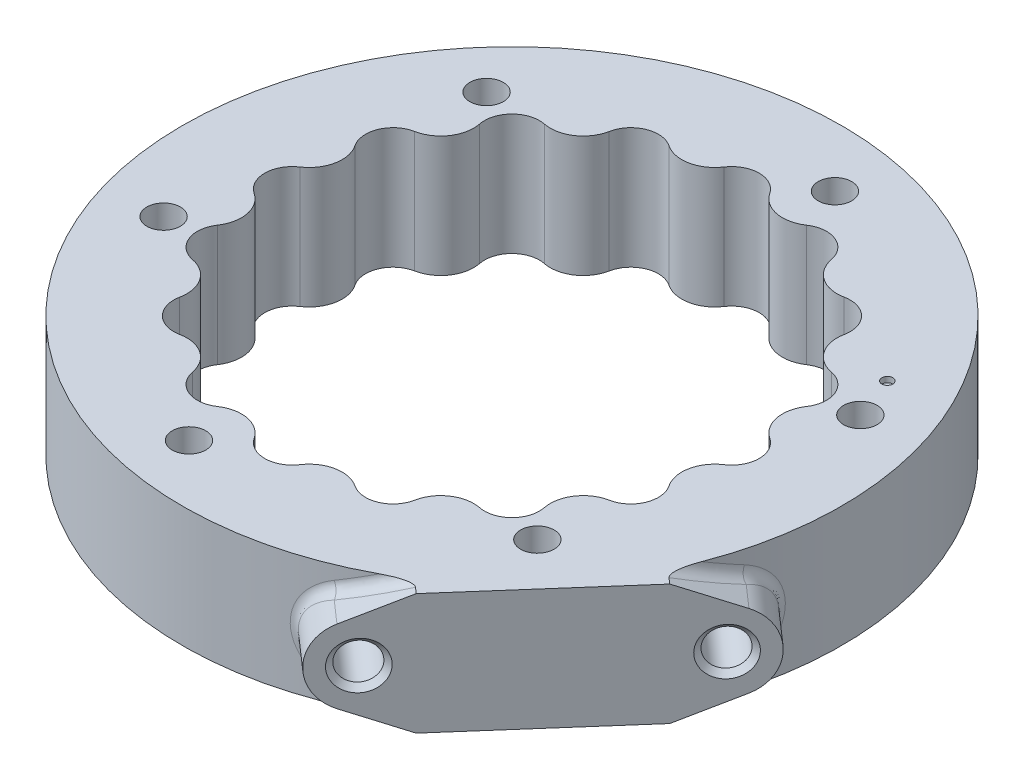
from build123d import *

# Parameters (mm, degrees)
SKETCH1_R                = 60
BOSS_EXTRUDE1_DEPTH      = 22
FILLET1_R                = 5
FILLET2_R                = 6
SKETCH3_R                = 3.05
CUT_EXTRUDE1_DEPTH       = 88.658428165
BOSS_EXTRUDE3_REACH      = 149.334
BOSS_EXTRUDE3_END_RADIUS = 60
SKETCH7_R                = 3.3
CUT_EXTRUDE3_DEPTH       = 10.5
CHAMFER2_SIZE            = 1
FILLET3_R                = 2
SKETCH8_W                = 32.70355213
SKETCH8_H                = 5.5
CUT_EXTRUDE4_DEPTH       = 149.347998989
SKETCH10_R               = 1
CUT_EXTRUDE6_DEPTH       = 1


with BuildPart() as part:
    # Sketch1 → Boss-Extrude1 (new body)
    with BuildSketch(Plane(origin=(0, 0, 0), x_dir=(1, 0, 0), z_dir=(0, 1, 0))):
        with Locations(Location((0, 0, 0), (0, 0, 270))):
            Circle(SKETCH1_R)
        with BuildLine():
            ThreePointArc((-31.591922188, 24.534678569), (-33.258784492, 22.222809321), (-34.756792584, 19.798115295))
            ThreePointArc((-34.756792584, 19.798115295), (-41.574578963, 17.220754456), (-38.576145309, 10.577382149))
            ThreePointArc((-38.576145309, 10.577382149), (-39.231411216, 7.803612881), (-39.6875, 4.99022482))
            ThreePointArc((-39.6875, 4.99022482), (-45, 0), (-39.6875, -4.99022482))
            ThreePointArc((-39.6875, -4.99022482), (-39.231411216, -7.803612881), (-38.576145309, -10.577382149))
            ThreePointArc((-38.576145309, -10.577382149), (-41.574578963, -17.220754456), (-34.756792584, -19.798115295))
            ThreePointArc((-34.756792584, -19.798115295), (-33.258784492, -22.222809321), (-31.591922188, -24.534678569))
            ThreePointArc((-31.591922188, -24.534678569), (-31.819805153, -31.819805153), (-24.534678569, -31.591922188))
            ThreePointArc((-24.534678569, -31.591922188), (-22.222809321, -33.258784492), (-19.798115295, -34.756792584))
            ThreePointArc((-19.798115295, -34.756792584), (-17.220754456, -41.574578963), (-10.577382149, -38.576145309))
            ThreePointArc((-10.577382149, -38.576145309), (-7.803612881, -39.231411216), (-4.99022482, -39.6875))
            ThreePointArc((-4.99022482, -39.6875), (0, -45), (4.99022482, -39.6875))
            ThreePointArc((4.99022482, -39.6875), (7.803612881, -39.231411216), (10.577382149, -38.576145309))
            ThreePointArc((10.577382149, -38.576145309), (17.220754456, -41.574578963), (19.798115295, -34.756792584))
            ThreePointArc((19.798115295, -34.756792584), (22.222809321, -33.258784492), (24.534678569, -31.591922188))
            ThreePointArc((24.534678569, -31.591922188), (31.819805153, -31.819805153), (31.591922188, -24.534678569))
            ThreePointArc((31.591922188, -24.534678569), (33.258784492, -22.222809321), (34.756792584, -19.798115295))
            ThreePointArc((34.756792584, -19.798115295), (41.574578963, -17.220754456), (38.576145309, -10.577382149))
            ThreePointArc((38.576145309, -10.577382149), (39.231411216, -7.803612881), (39.6875, -4.99022482))
            ThreePointArc((39.6875, -4.99022482), (45, 0), (39.6875, 4.99022482))
            ThreePointArc((39.6875, 4.99022482), (39.231411216, 7.803612881), (38.576145309, 10.577382149))
            ThreePointArc((38.576145309, 10.577382149), (41.574578963, 17.220754456), (34.756792584, 19.798115295))
            ThreePointArc((34.756792584, 19.798115295), (33.258784492, 22.222809321), (31.591922188, 24.534678569))
            ThreePointArc((31.591922188, 24.534678569), (31.819805153, 31.819805153), (24.534678569, 31.591922188))
            ThreePointArc((24.534678569, 31.591922188), (22.222809321, 33.258784492), (19.798115295, 34.756792584))
            ThreePointArc((19.798115295, 34.756792584), (17.220754456, 41.574578963), (10.577382149, 38.576145309))
            ThreePointArc((10.577382149, 38.576145309), (7.803612881, 39.231411216), (4.99022482, 39.6875))
            ThreePointArc((4.99022482, 39.6875), (0, 45), (-4.99022482, 39.6875))
            ThreePointArc((-4.99022482, 39.6875), (-7.803612881, 39.231411216), (-10.577382149, 38.576145309))
            ThreePointArc((-10.577382149, 38.576145309), (-17.220754456, 41.574578963), (-19.798115295, 34.756792584))
            ThreePointArc((-19.798115295, 34.756792584), (-22.222809321, 33.258784492), (-24.534678569, 31.591922188))
            ThreePointArc((-24.534678569, 31.591922188), (-31.819805153, 31.819805153), (-31.591922188, 24.534678569))
        make_face(mode=Mode.SUBTRACT)
    extrude(amount=BOSS_EXTRUDE1_DEPTH)

    # Fillet1
    # the kernel refuses this fillet: 5 mm, written as the material it takes off along each edge
    with BuildSketch(Plane(origin=(-31.591922188, -7.937782114, -24.534678569), x_dir=(-0.5708127348451637, 0, -0.8210802772802334), z_dir=(0, 1, 0))) as fillet1_piece_1:
        with BuildLine():
            CenterArc((3.572001951, 4.856162203), FILLET1_R, 201.908932705, 54.314665287)
            ThreePointArc((-1.066888508, 2.990500041), (-0.503760138, 1.505840103), (0, 0))
            ThreePointArc((0, 0), (1.190667317, 0.143837797), (2.381334634, 0))
        make_face()
    extrude(amount=37.875564228, mode=Mode.SUBTRACT)
    with BuildSketch(Plane(origin=(-34.756792584, -7.937782114, -19.798115295), x_dir=(-0.977019839336146, 0, -0.21314838386338178), z_dir=(0, 1, 0)), Plane(origin=(10.577382149, -7.937782114, 38.576145309), x_dir=(0.5401386861196337, 0, 0.8415760213771278), z_dir=(0, 1, 0)), Plane(origin=(-4.99022482, -7.937782114, 39.6875), x_dir=(0.176965876366712, 0, 0.984216987560041), z_dir=(0, 1, 0)), Plane(origin=(-19.798115295, -7.937782114, 34.756792584), x_dir=(-0.21314838386337953, 0, 0.9770198393361466), z_dir=(0, 1, 0)), Plane(origin=(-31.591922188, -7.937782114, 24.534678569), x_dir=(-0.5708127348451787, 0, 0.8210802772802229), z_dir=(0, 1, 0)), Plane(origin=(-38.576145309, -7.937782114, 10.577382149), x_dir=(-0.84157602137713, 0, 0.5401386861196305), z_dir=(0, 1, 0)), Plane(origin=(-39.6875, -7.937782114, -4.99022482), x_dir=(-0.9842169875600411, 0, 0.17696587636671054), z_dir=(0, 1, 0)), Plane(origin=(24.534678569, -7.937782114, 31.591922188), x_dir=(0.8210802772802258, 0, 0.5708127348451744), z_dir=(0, 1, 0)), Plane(origin=(34.756792584, -7.937782114, 19.798115295), x_dir=(0.9770198393361469, 0, 0.2131483838633775), z_dir=(0, 1, 0)), Plane(origin=(39.6875, -7.937782114, 4.99022482), x_dir=(0.9842169875600401, 0, -0.1769658763667165), z_dir=(0, 1, 0)), Plane(origin=(38.576145309, -7.937782114, -10.577382149), x_dir=(0.8415760213771245, 0, -0.5401386861196388), z_dir=(0, 1, 0)), Plane(origin=(31.591922188, -7.937782114, -24.534678569), x_dir=(0.5708127348451758, 0, -0.8210802772802248), z_dir=(0, 1, 0)), Plane(origin=(19.798115295, -7.937782114, -34.756792584), x_dir=(0.21314838386337198, 0, -0.9770198393361482), z_dir=(0, 1, 0)), Plane(origin=(4.99022482, -7.937782114, -39.6875), x_dir=(-0.17696587636672031, 0, -0.9842169875600394), z_dir=(0, 1, 0)), Plane(origin=(-10.577382149, -7.937782114, -38.576145309), x_dir=(-0.5401386861196261, 0, -0.8415760213771326), z_dir=(0, 1, 0)), Plane(origin=(-24.534678569, -7.937782114, -31.591922188), x_dir=(-0.82108027728022, 0, -0.5708127348451829), z_dir=(0, 1, 0))) as fillet1_piece_2:
        with BuildLine():
            CenterArc((3.572001951, -4.856162203), FILLET1_R, 103.776402008, 54.314665287)
            ThreePointArc((-1.066888508, -2.990500041), (-0.503760138, -1.505840103), (0, 0))
            ThreePointArc((0, 0), (1.190667317, -0.143837797), (2.381334634, 0))
        make_face()
    extrude(amount=37.875564228, mode=Mode.SUBTRACT)
    with BuildSketch(Plane(origin=(4.99022482, -7.937782114, 39.6875), x_dir=(0.9864543257067245, 0, -0.1640361645933343), z_dir=(0, 1, 0)), Plane(origin=(-10.577382149, -7.937782114, 38.576145309), x_dir=(0.9741388837762464, 0, 0.22595007217340898), z_dir=(0, 1, 0)), Plane(origin=(-24.534678569, -7.937782114, 31.591922188), x_dir=(0.8135196273818055, 0, 0.5815374586942516), z_dir=(0, 1, 0)), Plane(origin=(-34.756792584, -7.937782114, 19.798115295), x_dir=(0.5290493822922732, 0, 0.8485910387790836), z_dir=(0, 1, 0)), Plane(origin=(-39.6875, -7.937782114, 4.99022482), x_dir=(0.1640361645933272, 0, 0.9864543257067256), z_dir=(0, 1, 0)), Plane(origin=(-38.576145309, -7.937782114, -10.577382149), x_dir=(-0.22595007217340937, 0, 0.9741388837762464), z_dir=(0, 1, 0)), Plane(origin=(19.798115295, -7.937782114, 34.756792584), x_dir=(0.8485910387790846, 0, -0.5290493822922715), z_dir=(0, 1, 0)), Plane(origin=(31.591922188, -7.937782114, 24.534678569), x_dir=(0.5815374586942491, 0, -0.8135196273818073), z_dir=(0, 1, 0)), Plane(origin=(38.576145309, -7.937782114, 10.577382149), x_dir=(0.22595007217340277, 0, -0.9741388837762479), z_dir=(0, 1, 0)), Plane(origin=(39.6875, -7.937782114, -4.99022482), x_dir=(-0.16403616459333684, 0, -0.9864543257067241), z_dir=(0, 1, 0)), Plane(origin=(34.756792584, -7.937782114, -19.798115295), x_dir=(-0.5290493822922758, 0, -0.8485910387790819), z_dir=(0, 1, 0)), Plane(origin=(24.534678569, -7.937782114, -31.591922188), x_dir=(-0.8135196273818096, 0, -0.5815374586942458), z_dir=(0, 1, 0)), Plane(origin=(10.577382149, -7.937782114, -38.576145309), x_dir=(-0.9741388837762485, 0, -0.22595007217340046), z_dir=(0, 1, 0)), Plane(origin=(-4.99022482, -7.937782114, -39.6875), x_dir=(-0.9864543257067236, 0, 0.16403616459333964), z_dir=(0, 1, 0)), Plane(origin=(-19.798115295, -7.937782114, -34.756792584), x_dir=(-0.8485910387790874, 0, 0.5290493822922673), z_dir=(0, 1, 0))) as fillet1_piece_3:
        with BuildLine():
            CenterArc((3.373557398, -4.996060424), FILLET1_R, 92.274604499, 54.314665287)
            ThreePointArc((-0.800166381, -2.24287503), (-0.264608655, -1.169769307), (0, 0))
            ThreePointArc((0, 0), (1.587556423, -0.031516609), (3.175112846, 0))
        make_face()
    extrude(amount=37.875564228, mode=Mode.SUBTRACT)

    # Fillet2
    fillet2_edges = [part.edges().sort_by_distance(p)[0] for p in [
        (-7.805937782, 11, 39.243099283),
        (7.805937782, 11, 39.243099283),
        (22.229430079, 11, 33.268693157),
        (33.268693157, 11, 22.229430079),
        (-22.229430079, 11, 33.268693157),
        (-33.268693157, 11, 22.229430079),
        (-39.243099283, 11, 7.805937782),
        (-39.243099283, 11, -7.805937782),
        (39.243099283, 11, 7.805937782),
        (39.243099283, 11, -7.805937782),
        (33.268693157, 11, -22.229430079),
        (22.229430079, 11, -33.268693157),
        (7.805937782, 11, -39.243099283),
        (-7.805937782, 11, -39.243099283),
        (-22.229430079, 11, -33.268693157),
        (-33.268693157, 11, -22.229430079),
    ]]
    fillet(fillet2_edges, radius=FILLET2_R)

    # Sketch3 → Cut-Extrude1 (cut, through all)
    with BuildSketch(Plane(origin=(0, 22, 0), x_dir=(1, 0, 0), z_dir=(0, 1, 0))):
        with Locations(Location((9.754516101, 49.03926402, 0), (0, 0, 270))):
            Circle(SKETCH3_R)
        with Locations(Location((47.346506475, 16.071973265, 0), (0, 0, 270))):
            Circle(SKETCH3_R)
        with Locations(Location((37.591990374, -32.967290755, 0), (0, 0, 270))):
            Circle(SKETCH3_R)
        with Locations(Location((-9.754516101, -49.03926402, 0), (0, 0, 270))):
            Circle(SKETCH3_R)
        with Locations(Location((-47.346506475, -16.071973265, 0), (0, 0, 270))):
            Circle(SKETCH3_R)
        with Locations(Location((-37.591990374, 32.967290755, 0), (0, 0, 270))):
            Circle(SKETCH3_R)
    extrude(amount=-CUT_EXTRUDE1_DEPTH, mode=Mode.SUBTRACT)

    # Boss-Extrude3: up to this cylinder (the profile starts outside it)
    boss_extrude3_end = Plane(origin=(0, 11, 0), z_dir=(0, -1, 0)) * Cylinder(BOSS_EXTRUDE3_END_RADIUS, 419.668, mode=Mode.PRIVATE)
    # Sketch6 → Boss-Extrude3 (add, up to the surface)
    with BuildSketch(Plane(origin=(48.322940338, 0, 37.41419036), x_dir=(-0.6593458151000848, 0, 0.7518398074789634), z_dir=(-0.7518398074789634, 0, -0.6593458151000848)), mode=Mode.PRIVATE) as boss_extrude3_sk1:
        with BuildLine():
            Line((-22.841633403, 17.677522556), (-2.694264982, 26.197120299))
            ThreePointArc((-2.694264982, 26.197120299), (3.732050808, 27.5), (10.158366597, 26.197120299))
            Line((10.158366597, 26.197120299), (30.305735018, 17.677522556))
            ThreePointArc((30.305735018, 17.677522556), (34.732050808, 11), (30.305735018, 4.322477444))
            Line((30.305735018, 4.322477444), (10.158366597, -4.197120299))
            ThreePointArc((10.158366597, -4.197120299), (3.732050808, -5.5), (-2.694264982, -4.197120299))
            Line((-2.694264982, -4.197120299), (-22.841633403, 4.322477444))
            ThreePointArc((-22.841633403, 4.322477444), (-27.267949192, 11), (-22.841633403, 17.677522556))
        make_face()
    boss_extrude3_tool1 = extrude(boss_extrude3_sk1.sketch, amount=BOSS_EXTRUDE3_REACH, mode=Mode.PRIVATE) - boss_extrude3_end
    add(boss_extrude3_tool1.solids().sort_by_distance((45.862228, 11, 40.220095))[0])

    # Sketch7 → Cut-Extrude3 (cut)
    with BuildSketch(Plane(origin=(45.862228256, 0, 40.220094721), x_dir=(0.6593458151000849, 0, -0.7518398074789633), z_dir=(0.7518398074789633, 0, 0.6593458151000849))):
        with Locations((23.75, 11)):
            Circle(SKETCH7_R)
        with Locations((-23.75, 11)):
            Circle(SKETCH7_R)
    extrude(amount=-CUT_EXTRUDE3_DEPTH, mode=Mode.SUBTRACT)

    # Chamfer2
    chamfer2_edges = [part.edges().sort_by_distance(p)[0] for p in [
        (59.345850175, 11, 24.844970658),
        (28.026923958, 11, 60.557361513),
    ]]
    chamfer(chamfer2_edges, length=CHAMFER2_SIZE)

    # Fillet3
    fillet3_edges = [part.edges().sort_by_distance(p)[0] for p in [
        (56.305748885, 19.805835114, 20.728305345),
        (27.900346821, 2.194164886, 53.11845863),
        (59.062632001, 11, 10.564350485),
        (56.305748885, 2.194164886, 20.728305345),
        (18.18319146, 11, 57.178418554),
        (27.900346821, 19.805835114, 53.11845863),
    ]]
    fillet(fillet3_edges, radius=FILLET3_R)

    # Sketch8 → Cut-Extrude4 (cut, through all)
    with BuildSketch(Plane(origin=(45.862228256, 0, 40.220094721), x_dir=(0.6593458151000848, 0, -0.7518398074789634), z_dir=(0.7518398074789634, 0, 0.6593458151000848))):
        with Locations((0, 24.75)):
            Rectangle(SKETCH8_W, SKETCH8_H)
        with Locations((0, -2.75)):
            Rectangle(SKETCH8_W, SKETCH8_H)
    extrude(amount=-CUT_EXTRUDE4_DEPTH, mode=Mode.SUBTRACT)

    # Sketch10 → Cut-Extrude6 (cut)
    with BuildSketch(Plane(origin=(0, 22, 0), x_dir=(1, 0, 0), z_dir=(0, 1, 0))):
        with Locations(Location((44.425227151, 23.905313753, 0), (0, 0, 270))):
            Circle(SKETCH10_R)
    extrude(amount=-CUT_EXTRUDE6_DEPTH, mode=Mode.SUBTRACT)


solid = part.part
